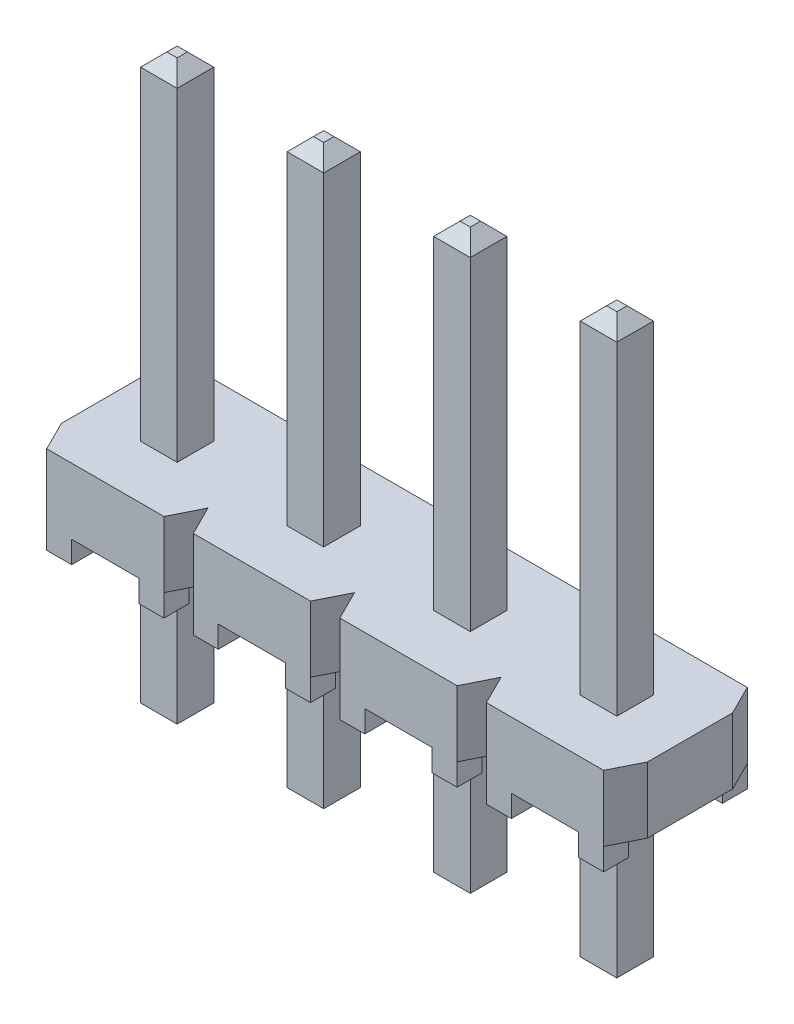
from build123d import *

# Parameters (mm, degrees)
SKETCH1_W                        = 10.16
SKETCH1_H                        = 2.4892
BASE_EXTRUDE_DEPTH               = 0.5715
SNAP_GROOVES_DEPTH               = 6.353678937
SKETCH4_W                        = 0.4318
SKETCH4_H                        = 0.4318
STANDOFFS_DEPTH                  = 0.381
POSITION_PATTERN_COUNT           = 4
POSITION_PATTERN_PITCH           = 2.54
SKETCH5_W                        = 0.635
SKETCH5_H                        = 10
TERMINAL_TH_DEPTH                = 0.3175
T1_TIP1_SIZE                     = 0.2286
TERMINAL_PATTERN_COUNT           = 4
TERMINAL_PATTERN_PITCH           = 2.54
T1_TIP1_OF_TERMINAL_PATTERN_SIZE = 0.2286


with BuildPart() as part:
    # Sketch1 → Base-Extrude (new, symmetric)
    with BuildSketch(Plane(origin=(0, 0, 0), x_dir=(1, 0, 0), z_dir=(0, 1, 0))):
        Rectangle(SKETCH1_W, SKETCH1_H)
    extrude(amount=BASE_EXTRUDE_DEPTH, both=True)

    # Sketch3 → Snap Grooves (cut, through all)
    with BuildSketch(Plane(origin=(0, 0.5715, 0), x_dir=(-1, 0, 0), z_dir=(0, 1, 0))):
        Polygon((2.286, 1.2446), (2.794, 1.2446), (2.54, 0.7366), align=None)
        Polygon((2.286, -1.2446), (2.794, -1.2446), (2.54, -0.7366), align=None)
        Polygon((5.08, -0.7366), (5.334, -1.2446), (4.826, -1.2446), align=None)
        Polygon((5.08, 0.7366), (5.334, 1.2446), (4.826, 1.2446), align=None)
    snap_grooves = extrude(amount=-SNAP_GROOVES_DEPTH, mode=Mode.SUBTRACT)

    # Sketch4 → Standoffs (add)
    with BuildSketch(Plane.XZ.offset(0.5715)):
        with Locations((-4.6101, 1.0287)):
            Rectangle(SKETCH4_W, SKETCH4_H)
        with Locations((-3.0099, 1.0287)):
            Rectangle(SKETCH4_W, SKETCH4_H)
        with Locations((-3.0099, -1.0287)):
            Rectangle(SKETCH4_W, SKETCH4_H)
        with Locations((-4.6101, -1.0287)):
            Rectangle(SKETCH4_W, SKETCH4_H)
    standoffs = extrude(amount=STANDOFFS_DEPTH)

    # Position Pattern: Snap Grooves, Standoffs ×4
    with Locations(*[(i * POSITION_PATTERN_PITCH, 0, 0) for i in range(1, POSITION_PATTERN_COUNT)]):
        add(snap_grooves, mode=Mode.SUBTRACT)
        add(standoffs)

    # Sketch5 → Terminal -TH (add, symmetric)
    with BuildSketch(Plane.ZY.offset(3.81)):
        with Locations((0, 1.4135)):
            Rectangle(SKETCH5_W, SKETCH5_H)
    terminal_th = extrude(amount=TERMINAL_TH_DEPTH, both=True)

    # T1 Tip1
    t1_tip1_edges = [part.edges().sort_by_distance(p)[0] for p in [
        (-3.4925, 6.4135, 0),
        (-3.81, 6.4135, -0.3175),
        (-4.1275, 6.4135, 0),
        (-3.81, 6.4135, 0.3175),
        (-3.81, -3.5865, -0.3175),
        (-4.1275, -3.5865, 0),
        (-3.81, -3.5865, 0.3175),
        (-3.4925, -3.5865, 0),
    ]]
    chamfer(t1_tip1_edges, length=T1_TIP1_SIZE)

    # Terminal Pattern: Terminal -TH ×4
    with Locations(*[(i * TERMINAL_PATTERN_PITCH, 0, 0) for i in range(1, TERMINAL_PATTERN_COUNT)]):
        add(terminal_th)

    # T1 Tip1 of Terminal Pattern
    t1_tip1_of_terminal_pattern_edges = [part.edges().sort_by_distance(p)[0] for p in [
        (-0.9525, 6.4135, 0),
        (-1.27, 6.4135, -0.3175),
        (-1.5875, 6.4135, 0),
        (-1.27, 6.4135, 0.3175),
        (-1.27, -3.5865, -0.3175),
        (-1.5875, -3.5865, 0),
        (-1.27, -3.5865, 0.3175),
        (-0.9525, -3.5865, 0),
        (1.5875, 6.4135, 0),
        (1.27, 6.4135, -0.3175),
        (0.9525, 6.4135, 0),
        (1.27, 6.4135, 0.3175),
        (1.27, -3.5865, -0.3175),
        (0.9525, -3.5865, 0),
        (1.27, -3.5865, 0.3175),
        (1.5875, -3.5865, 0),
        (4.1275, 6.4135, 0),
        (3.81, 6.4135, -0.3175),
        (3.4925, 6.4135, 0),
        (3.81, 6.4135, 0.3175),
        (3.81, -3.5865, -0.3175),
        (3.4925, -3.5865, 0),
        (3.81, -3.5865, 0.3175),
        (4.1275, -3.5865, 0),
    ]]
    chamfer(t1_tip1_of_terminal_pattern_edges, length=T1_TIP1_OF_TERMINAL_PATTERN_SIZE)


solid = part.part
